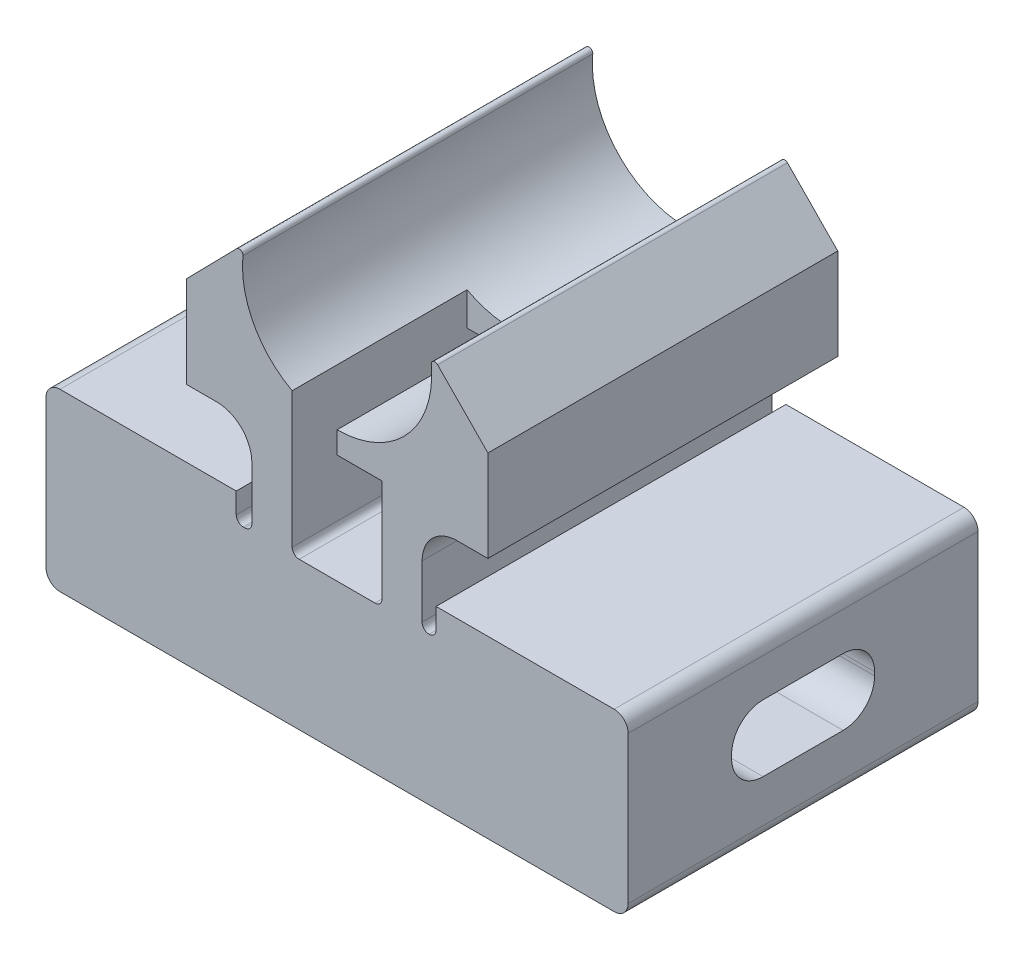
from build123d import *

# Parameters (mm, degrees)
BOSS_EXTRUDE9_DEPTH      = 6.35
SKETCH4_W                = 3.261538064
SKETCH4_H                = 3.965348827
CUT_EXTRUDE2_DEPTH       = 26.406776986
SKETCH5_W                = 1.630769032
SKETCH5_H                = 1.267236454
CUT_EXTRUDE6_DEPTH       = 6.35
SKETCH6_W                = 1.630769032
SKETCH6_H                = 1.247570224
CUT_EXTRUDE7_DEPTH       = 6.477
CUT_EXTRUDE9_DEPTH       = 23.902768758
CUT_EXTRUDE9_DEPTH_BACK  = 23.902768758
SKETCH8_W                = 0.566855721
SKETCH8_H                = 1.002964872
CUT_EXTRUDE10_DEPTH      = 26.406776986
CUT_EXTRUDE10_DEPTH_BACK = 26.406776986
SKETCH9_W                = 0.508
SKETCH9_H                = 1.002964872
FILLET1_R                = 0.254
FILLET2_R                = 0.254
FILLET3_R                = 0.254
FILLET4_R                = 0.508
FILLET5_R                = 0.508
SKETCH11_W               = 5.19034067
SKETCH11_H               = 2.415254944
CUT_EXTRUDE11_DEPTH      = 30.316944626
FILLET6_R                = 1.143


with BuildPart() as part:
    # Sketch2 → Boss-Extrude9 (new, symmetric)
    with BuildSketch(Plane.XY):
        with BuildLine():
            Line((-5.471488307, -10.4902), (-4.36371454, -10.4902))
            ThreePointArc((-4.36371454, -10.4902), (-3.465688928, -10.862174388), (-3.09371454, -11.7602))
            Line((-3.09371454, -11.7602), (-3.09371454, -12.937827191))
            Line((-3.09371454, -12.937827191), (-10.566399977, -12.937827191))
            Line((-10.566399977, -12.937827191), (-10.566399977, -19.301956075))
            Line((-10.566399977, -19.301956075), (10.566399977, -19.301956075))
            Line((10.566399977, -19.301956075), (10.566399977, -12.937827191))
            Line((10.566399977, -12.937827191), (3.086674887, -12.937827191))
            Line((3.086674887, -12.937827191), (3.086674887, -11.7602))
            ThreePointArc((3.086674887, -11.7602), (3.458649275, -10.862174388), (4.356674887, -10.4902))
            Line((4.356674887, -10.4902), (5.476039751, -10.4902))
            Line((5.476039751, -10.4902), (5.476039751, -7.173536635))
            Line((5.476039751, -7.173536635), (3.650231899, -5.31386943))
            ThreePointArc((3.650231899, -5.31386943), (3.496357897, -5.285953607), (3.418648834, -5.421665813))
            ThreePointArc((3.418648834, -5.421665813), (0.00035136, -9.18188013), (-3.418715481, -5.422365367))
            ThreePointArc((-3.418715481, -5.422365367), (-3.496506609, -5.286643819), (-3.650404442, -5.314701882))
            Line((-3.650404442, -5.314701882), (-5.471488307, -7.173600332))
            Line((-5.471488307, -7.173600332), (-5.471488307, -10.4902))
        make_face()
    extrude(amount=BOSS_EXTRUDE9_DEPTH, both=True)

    # Sketch4 → Cut-Extrude2 (cut, through all)
    with BuildSketch(Plane.XY.offset(6.35)):
        with Locations((0, -11.95811765)):
            Rectangle(SKETCH4_W, SKETCH4_H)
    extrude(amount=-CUT_EXTRUDE2_DEPTH, mode=Mode.SUBTRACT)

    # Sketch5 → Cut-Extrude6 (cut, symmetric)
    with BuildSketch(Plane.XY.offset(6.35)):
        with Locations((-0.815384516, -9.341825009)):
            Rectangle(SKETCH5_W, SKETCH5_H)
    extrude(amount=CUT_EXTRUDE6_DEPTH, both=True, mode=Mode.SUBTRACT)

    # Sketch6 → Cut-Extrude7 (cut, symmetric)
    with BuildSketch(Plane(origin=(0, 0, -6.35), x_dir=(-1, 0, 0), z_dir=(0, 0, -1))):
        with Locations((-0.815384516, -9.351658124)):
            Rectangle(SKETCH6_W, SKETCH6_H)
    extrude(amount=CUT_EXTRUDE7_DEPTH, both=True, mode=Mode.SUBTRACT)

    # Sketch8 → Cut-Extrude9 (cut, two sides: drawn at the far end of the back side and taken through both)
    with BuildSketch(Plane.XY.offset(-CUT_EXTRUDE9_DEPTH_BACK)):
        with Locations((-3.377142401, -13.439309627)):
            Rectangle(SKETCH8_W, SKETCH8_H)
    extrude(amount=CUT_EXTRUDE9_DEPTH + CUT_EXTRUDE9_DEPTH_BACK, mode=Mode.SUBTRACT)

    # Sketch9 → Cut-Extrude10 (cut, two sides: drawn at the far end of the back side and taken through both)
    with BuildSketch(Plane.XY.offset(6.35).offset(-CUT_EXTRUDE10_DEPTH_BACK)):
        with Locations((3.340674887, -13.439309627)):
            Rectangle(SKETCH9_W, SKETCH9_H)
    extrude(amount=CUT_EXTRUDE10_DEPTH + CUT_EXTRUDE10_DEPTH_BACK, mode=Mode.SUBTRACT)

    # Fillet1
    fillet1_edges = [part.edges().sort_by_distance(p)[0] for p in [
        (-3.09371454, -13.940792063, 0),
    ]]
    fillet(fillet1_edges, radius=FILLET1_R)

    # Fillet2
    fillet2_edges = [part.edges().sort_by_distance(p)[0] for p in [
        (-3.660570261, -13.940792063, 0),
    ]]
    fillet(fillet2_edges, radius=FILLET2_R)

    # Fillet3
    fillet3_edges = [part.edges().sort_by_distance(p)[0] for p in [
        (3.594674887, -13.940792063, 0),
        (3.086674887, -13.940792063, 0),
        (1.630769032, -13.940792063, 0),
        (-1.630769032, -13.940792063, 0),
    ]]
    fillet(fillet3_edges, radius=FILLET3_R - 0.0001)  # a hair under: the kernel refuses the full size

    # Fillet4
    fillet4_edges = [part.edges().sort_by_distance(p)[0] for p in [
        (-10.566399977, -12.937827191, 0),
    ]]
    fillet(fillet4_edges, radius=FILLET4_R)

    # Fillet5
    fillet5_edges = [part.edges().sort_by_distance(p)[0] for p in [
        (-10.566399977, -19.301956075, 0),
        (10.566399977, -12.937827191, 0),
        (10.566399977, -19.301956075, 0),
    ]]
    fillet(fillet5_edges, radius=FILLET5_R)

    # Sketch11 → Cut-Extrude11 (cut, through all)
    with BuildSketch(Plane.ZY.offset(10.566399977)):
        with Locations((0, -16.044100378)):
            Rectangle(SKETCH11_W, SKETCH11_H)
    extrude(amount=-CUT_EXTRUDE11_DEPTH, mode=Mode.SUBTRACT)

    # Fillet6
    fillet6_edges = [part.edges().sort_by_distance(p)[0] for p in [
        (0, -14.836472906, 2.595170335),
        (0, -17.25172785, 2.595170335),
        (0, -17.25172785, -2.595170335),
        (0, -14.836472906, -2.595170335),
    ]]
    fillet(fillet6_edges, radius=FILLET6_R)


solid = part.part
